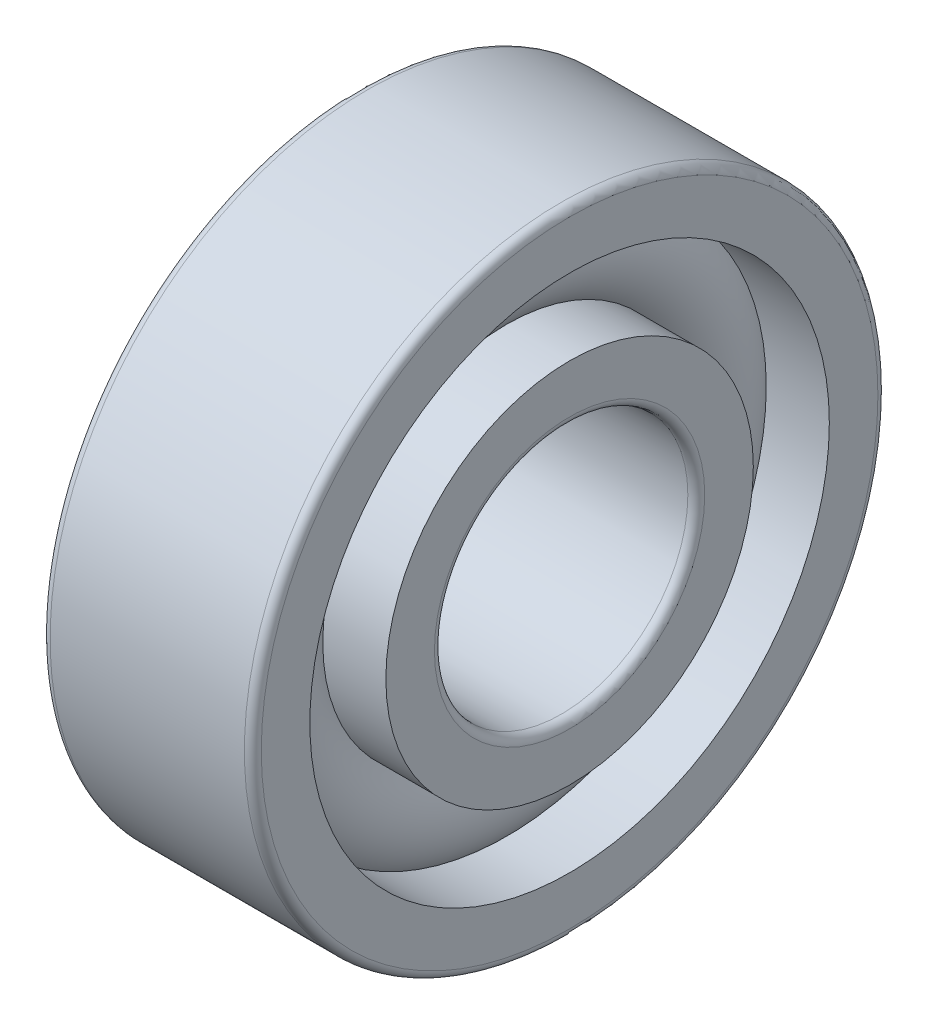
from build123d import *

# Parameters (mm, degrees)
CAGSPISKE_W     = 0.27
CAGSPISKE_H     = 0.45
CAGESPINE_ANGLE = 0.001
BALSIMSKE_R     = 1.35


with BuildPart() as part:
    # CagSpiSke → CageSpine (revolve)
    with BuildSketch(Plane.XY):
        with Locations((0, 5.25)):
            Rectangle(CAGSPISKE_W, CAGSPISKE_H)
    revolve(axis=Axis((-20.6375, 0, 0), (1, 0, 0)), revolution_arc=CAGESPINE_ANGLE)

    # BalSimSke → BallsSimplified (revolve)
    with BuildSketch(Plane.XY):
        with Locations((0, 5.25)):
            Circle(BALSIMSKE_R)
    revolve(axis=Axis((-10, 0, 0), (1, 0, 0)))

    # InnRacSke → InnerRace (revolve)
    with BuildSketch(Plane.XY):
        with BuildLine():
            Line((-0.972432517, 4.35), (-2.5, 4.35))
            Line((-2.5, 4.35), (-2.5, 3.2))
            ThreePointArc((-2.5, 3.2), (-2.441421356, 3.058578644), (-2.3, 3))
            Line((-2.3, 3), (2.3, 3))
            ThreePointArc((2.3, 3), (2.441421356, 3.058578644), (2.5, 3.2))
            Line((2.5, 3.2), (2.5, 4.35))
            Line((2.5, 4.35), (0.972432517, 4.35))
            ThreePointArc((0.972432517, 4.35), (0, 3.925), (-0.972432517, 4.35))
        make_face()
    revolve(axis=Axis((-20.6375, 0, 0), (1, 0, 0)))

    # OutRacSke → OuterRace (revolve)
    with BuildSketch(Plane.XY):
        with BuildLine():
            Line((-0.972432517, 6.15), (-2.5, 6.15))
            Line((-2.5, 6.15), (-2.5, 7.3))
            ThreePointArc((-2.5, 7.3), (-2.441421356, 7.441421356), (-2.3, 7.5))
            Line((-2.3, 7.5), (2.3, 7.5))
            ThreePointArc((2.3, 7.5), (2.441421356, 7.441421356), (2.5, 7.3))
            Line((2.5, 7.3), (2.5, 6.15))
            Line((2.5, 6.15), (0.972432517, 6.15))
            ThreePointArc((0.972432517, 6.15), (0, 6.575), (-0.972432517, 6.15))
        make_face()
    revolve(axis=Axis((-20.6375, 0, 0), (1, 0, 0)))


solid = part.part
